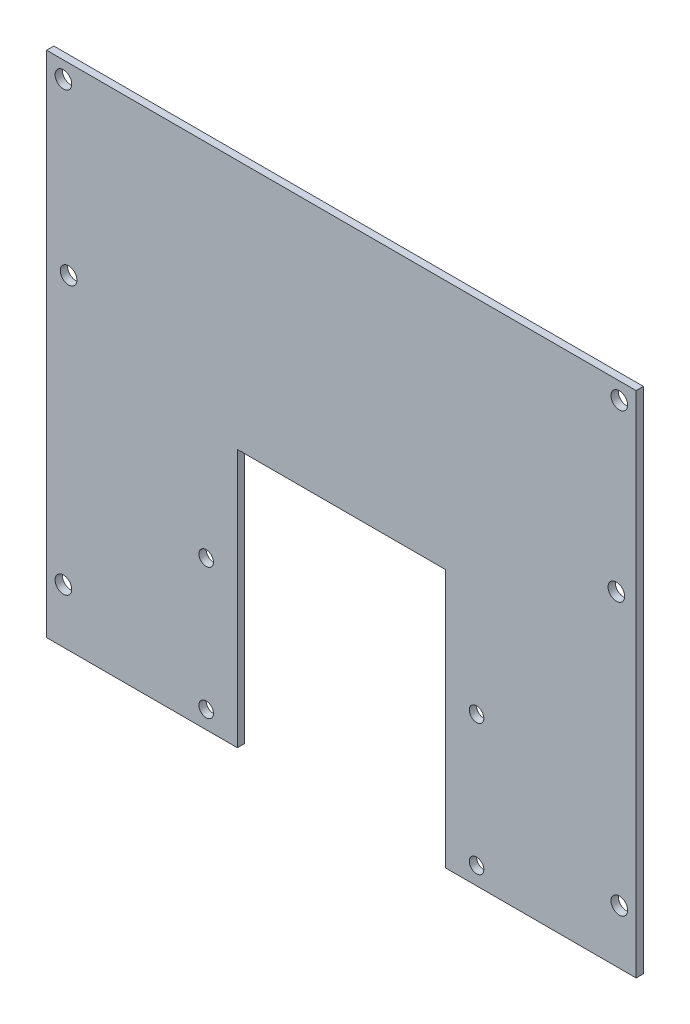
from build123d import *

# Parameters (mm, degrees)
BASE_FLANGE1_DEPTH    = 3.5
SKETCH2_R             = 3.5
CUT_EXTRUDE1_DEPTH    = 3.5
SKETCH3_R             = 4
CUT_EXTRUDE2_DEPTH    = 3.5
F_8_0MM_DOWEL_HOLE1_D = 8
F_8_0MM_DOWEL_HOLE2_D = 8


# Sheet-metal steps are written as plain solids
with BuildPart() as part:
    # Sketch1 → Base-Flange1 (new body)
    with BuildSketch(Plane.XY):
        Polygon((-54.2366, -134.59778982), (-54.2366, -10.36118982), (45.7634, -10.36118982), (45.7634, -134.59778982), (137.5, -134.59778982), (137.5, 110), (-145.9732, 110), (-145.9732, -134.59778982), align=None)
    extrude(amount=-BASE_FLANGE1_DEPTH)

    # Sketch2 → Cut-Extrude1 (cut)
    with BuildSketch(Plane(origin=(0, 0, -3.5), x_dir=(-1, 0, 0), z_dir=(0, 0, -1))):
        with Locations((-60.7634, -126.09778982)):
            Circle(SKETCH2_R)
        with Locations((69.2366, -126.09778982)):
            Circle(SKETCH2_R)
        with Locations((-60.7634, -63.09778982)):
            Circle(SKETCH2_R)
        with Locations((69.2366, -63.09778982)):
            Circle(SKETCH2_R)
    extrude(amount=-CUT_EXTRUDE1_DEPTH, mode=Mode.SUBTRACT)

    # Sketch3 → Cut-Extrude2 (cut)
    with BuildSketch(Plane(origin=(0, 0, -3.5), x_dir=(-1, 0, 0), z_dir=(0, 0, -1))):
        with Locations((137.8732, 101.9)):
            Circle(SKETCH3_R)
        with Locations((-129.4, 101.9)):
            Circle(SKETCH3_R)
        with Locations((-129.4, -108.47319982)):
            Circle(SKETCH3_R)
        with Locations((137.8732, -108.47319982)):
            Circle(SKETCH3_R)
    extrude(amount=-CUT_EXTRUDE2_DEPTH, mode=Mode.SUBTRACT)

    # Ø8.0mm Dowel Hole1 (through all)
    with Locations(Plane(origin=(-128.31605397, 74.62471448, 0), x_dir=(1, 0, 0), z_dir=(0, 0, 1))):
        with Locations((256.29328213, -53.092411223)):
            Hole(F_8_0MM_DOWEL_HOLE1_D / 2)

    # Ø8.0mm Dowel Hole2 (through all)
    with Locations(Plane(origin=(-128.31605397, 74.62471448, 0), x_dir=(1, 0, 0), z_dir=(0, 0, 1))):
        with Locations((-7.072415731, -53.092411223)):
            Hole(F_8_0MM_DOWEL_HOLE2_D / 2)


solid = part.part
